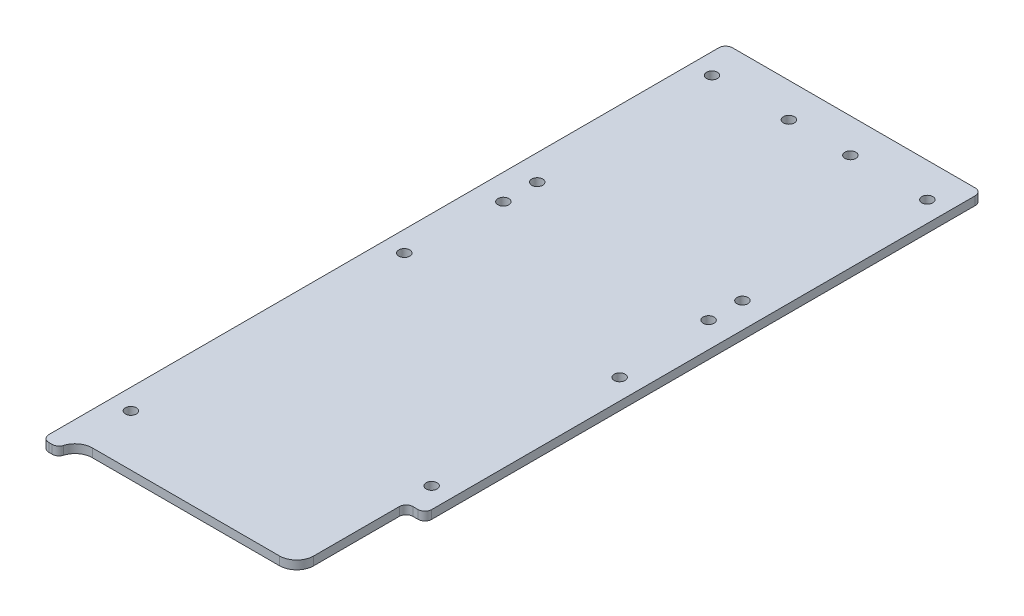
from build123d import *

# Parameters (mm, degrees)
SKETCH1_R           = 2.032
BOSS_EXTRUDE1_DEPTH = 3.175
FILLET1_R           = 2.54
FILLET2_R           = 2.54
FILLET3_R           = 6.35
CUT_EXTRUDE1_DEPTH  = 136.673215063
FILLET4_R           = 6.35
FILLET5_R           = 2.54
SKETCH3_R           = 2.032
CUT_EXTRUDE2_DEPTH  = 136.673215063


with BuildPart() as part:
    # Sketch1 → Boss-Extrude1 (new body)
    with BuildSketch(Plane(origin=(0, 0, 0), x_dir=(1, 0, 0), z_dir=(0, 1, 0))):
        Polygon((47.625, 127), (-47.625, 127), (-47.625, -127), (-41.275, -127), (-41.275, -120.65), (41.275, -120.65), (41.275, -127), (47.625, -127), align=None)
        with Locations((-39.999684148, -101.6)):
            Circle(SKETCH1_R, mode=Mode.SUBTRACT)
        with Locations((39.999684148, -69.85)):
            Circle(SKETCH1_R, mode=Mode.SUBTRACT)
        with Locations((-39.999684148, 0)):
            Circle(SKETCH1_R, mode=Mode.SUBTRACT)
        with Locations((-39.999684148, 114.3)):
            Circle(SKETCH1_R, mode=Mode.SUBTRACT)
        with Locations((-11.424684148, 114.3)):
            Circle(SKETCH1_R, mode=Mode.SUBTRACT)
        with Locations((39.999684148, 0)):
            Circle(SKETCH1_R, mode=Mode.SUBTRACT)
        with Locations((11.424684148, 114.3)):
            Circle(SKETCH1_R, mode=Mode.SUBTRACT)
        with Locations((39.999684148, 114.3)):
            Circle(SKETCH1_R, mode=Mode.SUBTRACT)
    extrude(amount=BOSS_EXTRUDE1_DEPTH)

    # Fillet1
    fillet1_edges = [part.edges().sort_by_distance(p)[0] for p in [
        (-47.625, 1.5875, -127),
        (47.625, 1.5875, -127),
        (47.625, 1.5875, 127),
        (-47.625, 1.5875, 127),
    ]]
    fillet(fillet1_edges, radius=FILLET1_R)

    # Fillet2
    fillet2_edges = [part.edges().sort_by_distance(p)[0] for p in [
        (41.275, 1.5875, 127),
        (-41.275, 1.5875, 127),
    ]]
    fillet(fillet2_edges, radius=FILLET2_R)

    # Fillet3
    fillet3_edges = [part.edges().sort_by_distance(p)[0] for p in [
        (41.275, 1.5875, 120.65),
        (-41.275, 1.5875, 120.65),
    ]]
    fillet(fillet3_edges, radius=FILLET3_R)

    # Sketch2 → Cut-Extrude1 (cut, through all)
    with BuildSketch(Plane.XZ):
        with BuildLine():
            Line((47.625, 131.883089137), (41.910219141, 131.883089137))
            Line((41.910219141, 131.883089137), (41.910219141, 126.140300532))
            ThreePointArc((41.910219141, 126.140300532), (41.593666331, 125.691777874), (41.380880287, 125.185714286))
            ThreePointArc((41.380880287, 125.185714286), (41.06728879, 124.352380455), (40.640219141, 123.57110175))
            Line((40.640219141, 123.57110175), (40.640219141, 79.981419179))
            Line((40.640219141, 79.981419179), (47.625, 79.981419179))
            Line((47.625, 79.981419179), (47.625, 131.883089137))
        make_face()
    extrude(amount=-CUT_EXTRUDE1_DEPTH, mode=Mode.SUBTRACT)

    # Fillet4
    fillet4_edges = [part.edges().sort_by_distance(p)[0] for p in [
        (40.640219141, 1.5875, 123.57110175),
    ]]
    fillet(fillet4_edges, radius=FILLET4_R)

    # Fillet5
    fillet5_edges = [part.edges().sort_by_distance(p)[0] for p in [
        (47.625, 1.5875, 79.981419179),
        (40.640219141, 1.5875, 79.981419179),
    ]]
    fillet(fillet5_edges, radius=FILLET5_R)

    # Sketch3 → Cut-Extrude2 (cut, through all)
    with BuildSketch(Plane.XZ):
        with Locations((-38.113704285, -34.91376088)):
            Circle(SKETCH3_R)
        with Locations((-38.113704285, -47.490165353)):
            Circle(SKETCH3_R)
        with Locations((38.113704285, -47.490165353)):
            Circle(SKETCH3_R)
        with Locations((38.113704285, -34.91376088)):
            Circle(SKETCH3_R)
    extrude(amount=-CUT_EXTRUDE2_DEPTH, mode=Mode.SUBTRACT)


solid = part.part
